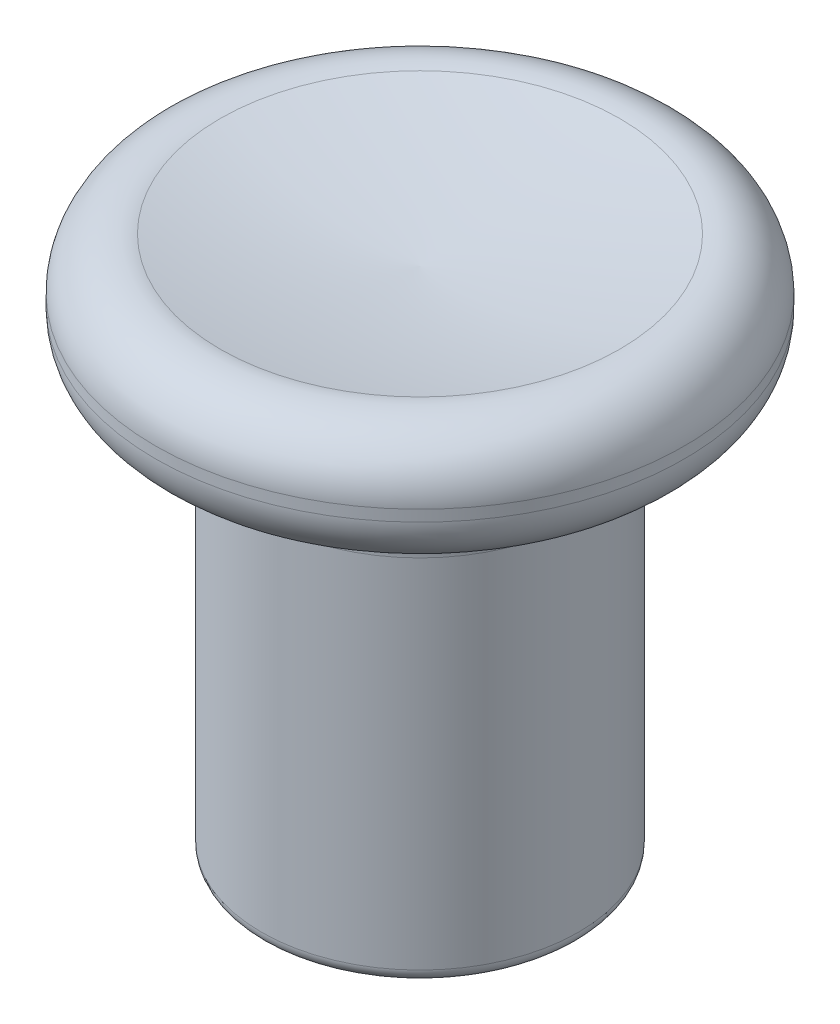
from build123d import *

# Parameters (mm, degrees)
SKETCH_1_R      = 6
SKETCH_1_R_2    = 4.5
EXTRUDE_1_DEPTH = 16
SKETCH_2_R      = 10
EXTRUDE_2_DEPTH = 5
FILLET_1_R      = 2
FILLET_2_R      = 0.5


with BuildPart() as part:
    # 草圖1 → 填料-伸長1 (new body)
    with BuildSketch(Plane(origin=(0, 0, 0), x_dir=(1, 0, 0), z_dir=(0, 1, 0))):
        with Locations(Location((0, 0, 0), (0, 0, 270))):
            Circle(SKETCH_1_R)
        with Locations(Location((0, 0, 0), (0, 0, 270))):
            Circle(SKETCH_1_R_2, mode=Mode.SUBTRACT)
    extrude(amount=EXTRUDE_1_DEPTH)

    # 草圖2 → 填料-伸長2 (add)
    with BuildSketch(Plane(origin=(0, 16, 0), x_dir=(1, 0, 0), z_dir=(0, 1, 0))):
        with Locations(Location((0, 0, 0), (0, 0, 270))):
            Circle(SKETCH_2_R)
    extrude(amount=EXTRUDE_2_DEPTH)

    # 草圖3 → 除料-旋轉1 (revolve, cut)
    with BuildSketch(Plane(origin=(0, 0, 0), x_dir=(0, 0, -1), z_dir=(1, 0, 0))):
        with BuildLine():
            Line((0, 21), (0, 19.316289144))
            add(Edge.make_bspline(
                [(-10, 21), (-5.090329438, 19.596139372), (0, 19.316289144)],
                knots=[0, 0, 0, 1, 1, 1], degree=2))
            Line((-10, 21), (0, 21))
        make_face()
    revolve(axis=Axis((0, 21, 0), (0, -1, 0)), mode=Mode.SUBTRACT)

    # 圓角1
    fillet_1_edges = [part.edges().sort_by_distance(p)[0] for p in [
        (0, 21, -10),
        (0, 16, -6),
        (0, 16, -10),
    ]]
    fillet(fillet_1_edges, radius=FILLET_1_R - 0.0001)  # a hair under: the kernel refuses the full size

    # 圓角2
    fillet_2_edges = [part.edges().sort_by_distance(p)[0] for p in [
        (0, 0, -6),
        (0, 0, -4.5),
    ]]
    fillet(fillet_2_edges, radius=FILLET_2_R)


solid = part.part
